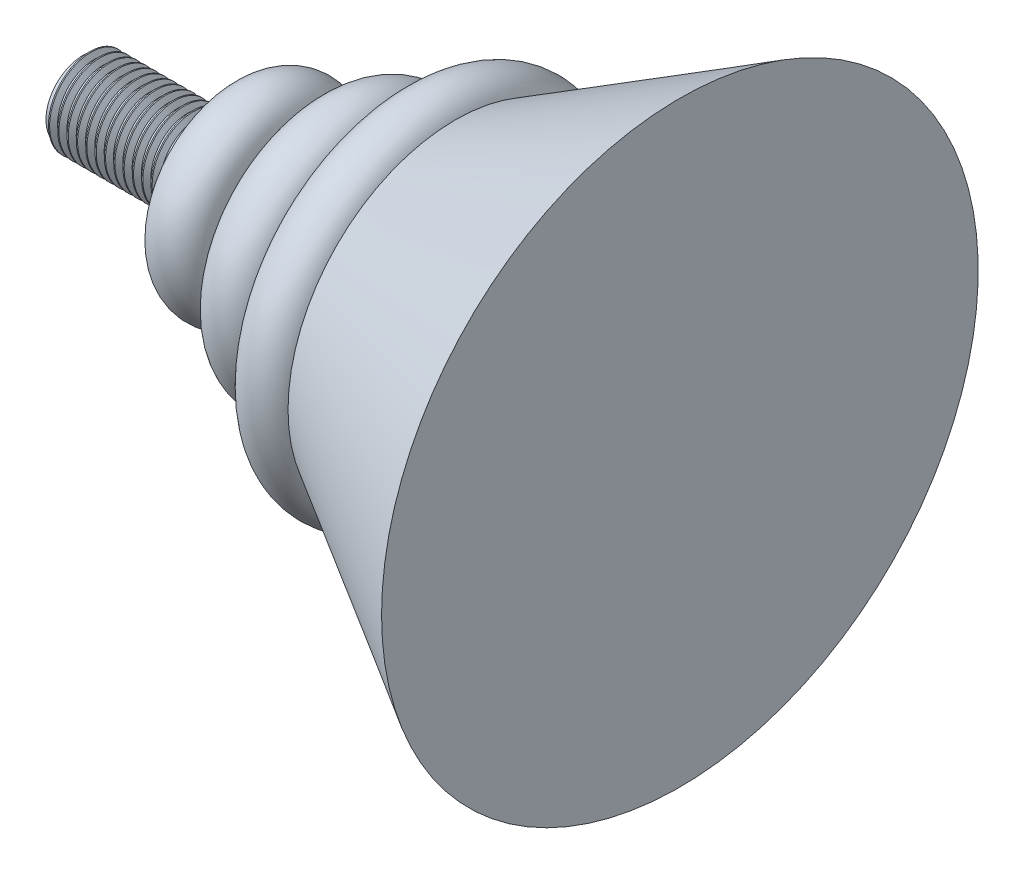
from build123d import *

# Parameters (mm, degrees)
THREAD2_PITCH = 1.25


with BuildPart() as part:
    # Sketch1 → Revolve1 (revolve)
    with BuildSketch(Plane.XY, mode=Mode.PRIVATE) as revolve1_sk:
        with BuildLine():
            Line((-68.564578963, 0), (-68.564578963, 5))
            Line((-68.564578963, 5), (-48.564578963, 5))
            Line((-48.564578963, 5), (-48.564578963, 11.550323332))
            ThreePointArc((-48.564578963, 11.550323332), (-43.974768127, 13.370522575), (-41.113912898, 9.346221871))
            Line((-41.113912898, 9.346221871), (-36.795018393, 11.865576999))
            ThreePointArc((-36.795018393, 11.865576999), (-35.355386892, 17.336176705), (-29.884787186, 15.896545203))
            Line((-29.884787186, 15.896545203), (-25.565892682, 18.415900331))
            ThreePointArc((-25.565892682, 18.415900331), (-24.12626118, 23.886500037), (-18.655661474, 22.446868535))
            Line((-18.655661474, 22.446868535), (11.435421037, 40))
            Line((11.435421037, 40), (11.435421037, 0))
            Line((11.435421037, 0), (-68.564578963, 0))
        make_face()
    revolve(revolve1_sk.sketch.rotate(Axis((-68.564578963, 0, 0), (1, 0, 0)), 90), axis=Axis((-68.564578963, 0, 0), (1, 0, 0)))

    # Thread2: the profile of Thread Profile3 profile screwed along a right-hand helix of 32 turns, 8 arcs to a turn; built about Z, then put on its axis
    thread2_z = Axis((0, 0, 0), (0, 0, 1))
    thread2_corners = [(4.9997, 0, -0.000173205), (5.676582344, 0, 0.390624998), (5.676582344, 0, 0.546874998), (4.9997, 0, 0.937673202)]
    with BuildLine(mode=Mode.PRIVATE) as thread2_profile:
        Line(thread2_corners[0], thread2_corners[1])
        Line(thread2_corners[1], thread2_corners[2])
        Line(thread2_corners[2], thread2_corners[3])
        Line(thread2_corners[3], thread2_corners[0])
    thread2_cap = Face(thread2_profile.wire())
    thread2_turn_angles = [0, 22.5, 45, 67.5, 90, 112.5, 135, 157.5, 180, 202.5, 225, 247.5, 270, 292.5, 315, 337.5, 360]
    thread2_turn_weights = [1, 0.9238795325112867, 1, 0.9238795325112867, 1, 0.9238795325112867, 1, 0.9238795325112867, 1, 0.9238795325112867, 1, 0.9238795325112867, 1, 0.9238795325112867, 1, 0.9238795325112867, 1]
    thread2_turn_rails = [Edge.make_bspline([Vector(p[0], p[1], 0).rotate(thread2_z, thread2_turn_angles[k]) / thread2_turn_weights[k] + Vector(0, 0, p[2] + THREAD2_PITCH * thread2_turn_angles[k] / 360) for k in range(17)], [0, 0, 0, 1, 1, 2, 2, 3, 3, 4, 4, 5, 5, 6, 6, 7, 7, 8, 8, 8], 2, thread2_turn_weights) for p in thread2_corners]
    thread2_turn_sides = [Face.make_surface_from_curves(thread2_turn_rails[p[0]], thread2_turn_rails[p[1]]) for p in [(0, 1), (1, 2), (2, 3), (3, 0)]]
    thread2 = Plane(origin=(-68.564578963, 0, 0), x_dir=(0, 0, -1), z_dir=(1, 0, 0)) * Solid(Shell([*[p.moved(Location((0, 0, THREAD2_PITCH * i))) for i in range(32) for p in thread2_turn_sides], thread2_cap, thread2_cap.rotate(thread2_z, 11520).moved(Location((0, 0, THREAD2_PITCH * 11520 / 360)))]))
    add(thread2)


solid = part.part
